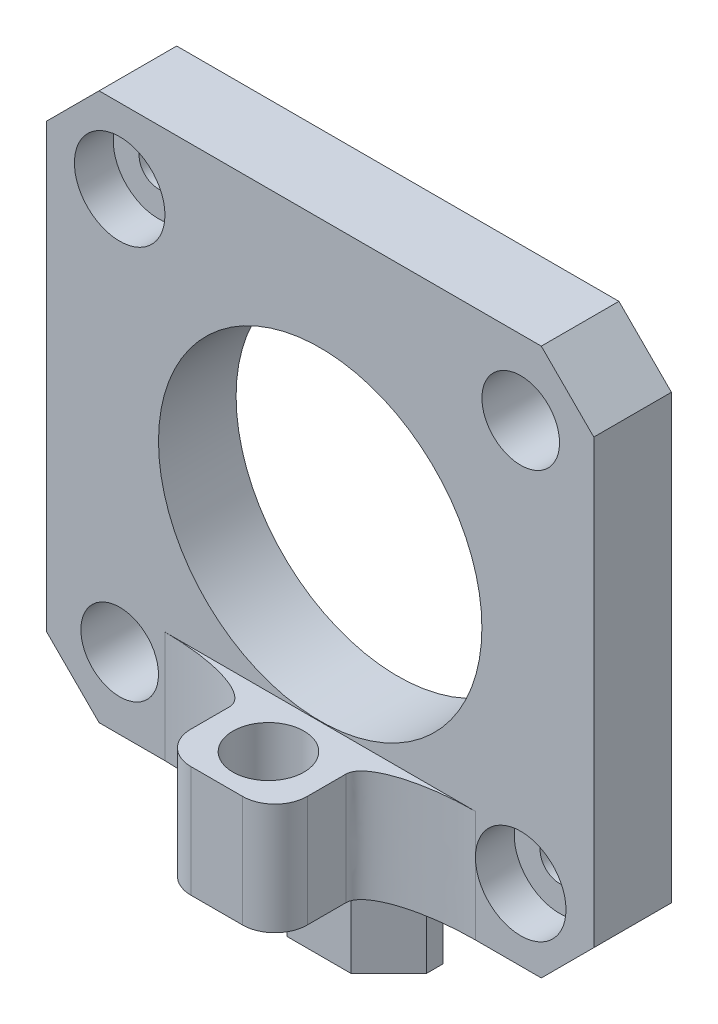
from build123d import *

# Parameters (mm, degrees)
SKETCH1_R                    = 11025
BOSS_EXTRUDE1_DEPTH          = 5000
BOSS_EXTRUDE2_DEPTH          = 8000
SKETCH4_R                    = 3000
CUT_EXTRUDE2_DEPTH           = 3000
SKETCH5_R                    = 1500
CUT_EXTRUDE3_DEPTH           = 3000
SKETCH6_R                    = 3000
CUT_EXTRUDE4_DEPTH           = 3000
SKETCH3_R                    = 2900
CUT_EXTRUDE1_DEPTH           = 12018
SCALE6_SCALE                 = 0.001
CORTAR_EXTRUIR1_DEPTH        = 10
CORTAR_EXTRUIR1_DEPTH_BACK   = 10
CROQUIS1_R                   = 12.5
CROQUIS2_W                   = 9
CROQUIS2_H                   = 0.876479878
CORTAR_EXTRUIR2_DEPTH        = 8
CROQUIS4_R                   = 2.9
CROQUIS4_R_2                 = 2.4
SALIENTE_EXTRUIR2_DEPTH      = 8.611616332
CROQUIS5_R                   = 3.5
CORTAR_EXTRUIR3_DEPTH        = 3
CROQUIS6_R                   = 1.591781054
CROQUIS6_R_2                 = 3
CROQUIS6_R_3                 = 1.5
CROQUIS6_R_4                 = 12.5
SALIENTE_EXTRUIR3_DEPTH      = 1
REDONDEO1_R                  = 2.5
TALADRO_DE_MARGEN_PARA_M51_D = 5.5
SALIENTE_EXTRUIR4_DEPTH      = 7
REDONDEO2_SIZE               = 2.5
REDONDEO2_SIZE_2             = 7.5


with BuildPart() as part:
    # Sketch1 → Boss-Extrude1 (new body)
    with BuildSketch(Plane.XY):
        Polygon((-21150, 17212.99935917), (-17091.781053823, 21271.218305346), (17091.781053823, 21271.218305346), (21150, 17212.99935917), (21150, -16970.562748477), (17091.781053823, -21028.781694654), (-17091.781053823, -21028.781694654), (-21150, -16970.562748477), align=None)
        with Locations((0, 121.218305346)):
            Circle(SKETCH1_R, mode=Mode.SUBTRACT)
    extrude(amount=BOSS_EXTRUDE1_DEPTH)

    # Sketch2 → Boss-Extrude2 (add)
    with BuildSketch(Plane.XY.offset(5000)):
        Polygon((0, -11028.781694654), (4500, -11028.781694654), (4500, -21028.781694654), (-4500, -21028.781694654), (-4500, -11028.781694654), align=None)
    extrude(amount=BOSS_EXTRUDE2_DEPTH)

    # Sketch4 → Cut-Extrude2 (cut)
    with BuildSketch(Plane.XY.offset(5000)):
        with Locations((-15500, 15500)):
            Circle(SKETCH4_R)
        with Locations((15500, 15500)):
            Circle(SKETCH4_R)
        with Locations((15500, -15500)):
            Circle(SKETCH4_R)
        with Locations((-15500, -15500)):
            Circle(SKETCH4_R)
    extrude(amount=-CUT_EXTRUDE2_DEPTH, mode=Mode.SUBTRACT)

    # Sketch5 → Cut-Extrude3 (cut)
    with BuildSketch(Plane.XY.offset(2000)):
        with Locations((-15500, 15500)):
            Circle(SKETCH5_R)
        with Locations((15500, -15500)):
            Circle(SKETCH5_R)
    extrude(amount=-CUT_EXTRUDE3_DEPTH, mode=Mode.SUBTRACT)

    # Sketch6 → Cut-Extrude4 (cut)
    with BuildSketch(Plane.XY.offset(2000)):
        with Locations((15500, 15500)):
            Circle(SKETCH6_R)
        with Locations((-15500, -15500)):
            Circle(SKETCH6_R)
    extrude(amount=-CUT_EXTRUDE4_DEPTH, mode=Mode.SUBTRACT)

    # Sketch3 → Cut-Extrude1 (cut)
    with BuildSketch(Plane.XZ.offset(21028.781694654)):
        with Locations(Location((0, 9000, 0), (0, 0, 270))):
            Circle(SKETCH3_R)
    extrude(amount=-CUT_EXTRUDE1_DEPTH, mode=Mode.SUBTRACT)


with BuildPart() as part_1:
    # Scale6: scaled about (0, -945.258123271, 2914.075668663)
    add(part.part.scale(SCALE6_SCALE).moved(Location((0, -944.312865148, 2911.161592994))))

    # Croquis1 → Cortar-Extruir1 (cut, two sides: drawn at the far end of the back side and taken through both)
    with BuildSketch(Plane.XY.offset(2916.161592994).offset(-CORTAR_EXTRUIR1_DEPTH_BACK)):
        with Locations(Location((0, -944.191646843, 0), (0, 0, 248.899803976))):
            Circle(CROQUIS1_R)
    extrude(amount=CORTAR_EXTRUIR1_DEPTH + CORTAR_EXTRUIR1_DEPTH_BACK, mode=Mode.SUBTRACT)

    # Croquis2 → Cortar-Extruir2 (cut)
    with BuildSketch(Plane.XY.offset(2924.161592994)):
        with Locations((0, -956.291790571)):
            Rectangle(CROQUIS2_W, CROQUIS2_H)
    extrude(amount=-CORTAR_EXTRUIR2_DEPTH, mode=Mode.SUBTRACT)

    # Croquis4 → Saliente-Extruir2 (add)
    with BuildSketch(Plane.XZ.offset(965.341646843)):
        with Locations((0, 2920.161592994)):
            Circle(CROQUIS4_R)
        with Locations(Location((0, 2920.161592994, 0), (0, 0, 270))):
            Circle(CROQUIS4_R_2, mode=Mode.SUBTRACT)
    extrude(amount=-SALIENTE_EXTRUIR2_DEPTH)

    # Croquis5 → Cortar-Extruir3 (cut)
    with BuildSketch(Plane.XY.offset(2916.161592994)):
        with Locations((-15.5, -928.812865148)):
            Circle(CROQUIS5_R)
        with Locations((15.5, -959.812865148)):
            Circle(CROQUIS5_R)
    extrude(amount=-CORTAR_EXTRUIR3_DEPTH, mode=Mode.SUBTRACT)

    # Croquis6 → Saliente-Extruir3 (add)
    with BuildSketch(Plane(origin=(0, 0, 2911.161592994), x_dir=(-1, 0, 0), z_dir=(0, 0, -1))):
        Polygon((17.091781054, -923.041646843), (-17.091781054, -923.041646843), (-21.15, -927.099865789), (-21.15, -961.283427896), (-17.091781054, -965.341646843), (17.091781054, -965.341646843), (21.15, -961.283427896), (21.15, -927.099865789), align=None)
        with Locations((15.5, -928.812865148)):
            Circle(CROQUIS6_R, mode=Mode.SUBTRACT)
        with Locations(Location((-15.5, -928.812865148, 0), (0, 0, 180))):
            Circle(CROQUIS6_R_2, mode=Mode.SUBTRACT)
        with Locations(Location((-15.5, -959.812865148, 0), (0, 0, 180))):
            Circle(CROQUIS6_R_3, mode=Mode.SUBTRACT)
        with Locations(Location((15.5, -959.812865148, 0), (0, 0, 180))):
            Circle(CROQUIS6_R_2, mode=Mode.SUBTRACT)
        with Locations((0, -944.191646843)):
            Circle(CROQUIS6_R_4, mode=Mode.SUBTRACT)
    extrude(amount=SALIENTE_EXTRUIR3_DEPTH)

    # Redondeo1
    redondeo1_edges = [part_1.edges().sort_by_distance(p)[0] for p in [
        (4.5, -961.035838676, 2924.161592994),
        (-4.5, -961.035838676, 2924.161592994),
    ]]
    fillet(redondeo1_edges, radius=REDONDEO1_R)

    # Taladro de margen para M51 (through all)
    with Locations(Plane(origin=(0, -956.73003051, 2920.161592994), x_dir=(0, 0, 1), z_dir=(0, 1, 0))):
        with Locations((0, 0)):
            Hole(TALADRO_DE_MARGEN_PARA_M51_D / 2)

    # Croquis8 → Saliente-Extruir4 (add)
    with BuildSketch(Plane.XZ.offset(965.341646843)):
        Polygon((-2.879289322, 2912.011592994), (-5.45, 2912.011592994), (-5.45, 2913.290882316), (-2.529289322, 2916.211592994), (2.429289322, 2916.211592994), (5.35, 2913.290882316), (5.35, 2912.011592994), (2.879289322, 2912.011592994), (2.879289322, 2910.161592994), (-2.879289322, 2910.161592994), align=None)
    extrude(amount=SALIENTE_EXTRUIR4_DEPTH)

    # Redondeo2
    # an asymmetric fillet: 7.5, 2.5 mm, written as the material it adds along each edge
    with BuildSketch(Plane(origin=(4.5, -956.73003051, 2916.161592994), x_dir=(0, 0, 1), z_dir=(0, -1, 0))) as redondeo2_piece_1:
        with BuildLine():
            Bezier((REDONDEO2_SIZE, 0), (0, 0), (0, -REDONDEO2_SIZE_2), weights=[1, 0.707106781, 1])
            Line((0, -REDONDEO2_SIZE_2), (0, 0))
            Line((0, 0), (REDONDEO2_SIZE, 0))
        make_face()
    extrude(amount=8.611616332)
    with BuildSketch(Plane(origin=(-4.5, -965.341646842, 2916.161592994), x_dir=(-1, 0, 0), z_dir=(0, 1, 0))) as redondeo2_piece_2:
        with BuildLine():
            Bezier((REDONDEO2_SIZE_2, 0), (0, 0), (0, REDONDEO2_SIZE), weights=[1, 0.707106781, 1])
            Line((0, REDONDEO2_SIZE), (0, 0))
            Line((0, 0), (REDONDEO2_SIZE_2, 0))
        make_face()
    extrude(amount=8.611616332)


solid = part_1.part
